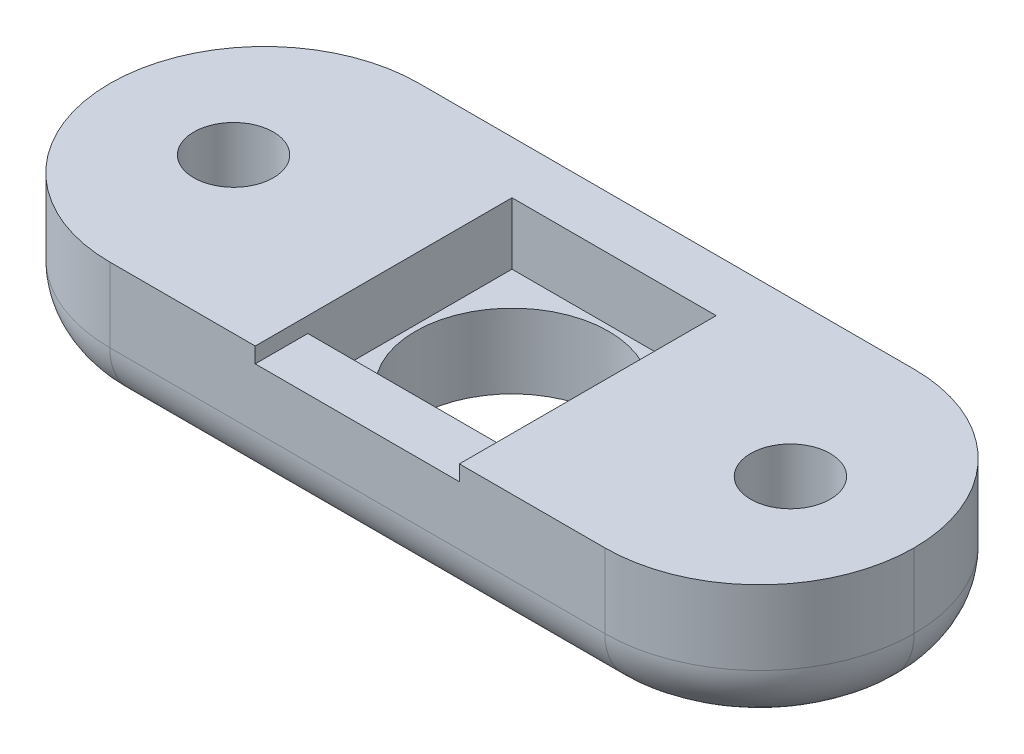
from build123d import *

# Parameters (mm, degrees)
SKETCH1_W                 = 33.02
SKETCH1_H                 = 12.7
SKETCH1_R                 = 3.96875
BOSS_EXTRUDE1_DEPTH       = 5.588
SKETCH2_W                 = 8.382
SKETCH2_H                 = 8.382
CUT_EXTRUDE1_DEPTH        = 2.54
F_4_CLEARANCE_HOLE1_D     = 3.2639
F_4_CLEARANCE_HOLE1_DEPTH = 12.7
F_4_CLEARANCE_HOLE1_TIP   = 0.980574487
FILLET1_R                 = 6.35
SKETCH7_W                 = 8.382
SKETCH7_H                 = 2.159
CUT_EXTRUDE2_DEPTH        = 0.635
SKETCH9_R                 = 2.54
CUT_EXTRUDE3_DEPTH        = 3.175
FILLET3_R                 = 2.54


# Some blends are built 0.0001 mm under size
with BuildPart() as part:
    # Sketch1 → Boss-Extrude1 (new body)
    with BuildSketch(Plane(origin=(0, 0, 0), x_dir=(1, 0, 0), z_dir=(0, 1, 0))):
        with Locations((-15.345948133, 4.349128799)):
            Rectangle(SKETCH1_W, SKETCH1_H)
        with Locations(Location((-15.345948133, 4.349128799, 0), (0, 0, 270))):
            Circle(SKETCH1_R, mode=Mode.SUBTRACT)
    extrude(amount=BOSS_EXTRUDE1_DEPTH)

    # Sketch2 → Cut-Extrude1 (cut)
    with BuildSketch(Plane(origin=(0, 5.588, 0), x_dir=(1, 0, 0), z_dir=(0, 1, 0))):
        with Locations((-15.345948133, 4.349128799)):
            Rectangle(SKETCH2_W, SKETCH2_H)
    extrude(amount=-CUT_EXTRUDE1_DEPTH, mode=Mode.SUBTRACT)

    # #4 Clearance Hole1
    with Locations(Plane(origin=(0, 0, 0), x_dir=(-1, 0, 0), z_dir=(0, -1, 0))):
        with Locations((3.915948133, 4.349128799), (26.775948133, 4.349128799)):
            Hole(F_4_CLEARANCE_HOLE1_D / 2, depth=F_4_CLEARANCE_HOLE1_DEPTH)
            with Locations((0, 0, -(F_4_CLEARANCE_HOLE1_DEPTH + F_4_CLEARANCE_HOLE1_TIP / 2))):  # 118° drill point
                Cone(0, F_4_CLEARANCE_HOLE1_D / 2, F_4_CLEARANCE_HOLE1_TIP, mode=Mode.SUBTRACT)

    # Fillet1
    fillet1_edges = [part.edges().sort_by_distance(p)[0] for p in [
        (-31.855948133, 2.794, 2.000871201),
        (-31.855948133, 2.794, -10.699128799),
        (1.164051867, 2.794, -10.699128799),
        (1.164051867, 2.794, 2.000871201),
    ]]
    fillet(fillet1_edges, radius=FILLET1_R - 0.0001)  # a hair under: the kernel refuses the full size

    # Sketch7 → Cut-Extrude2 (cut)
    with BuildSketch(Plane(origin=(0, 5.588, 0), x_dir=(1, 0, 0), z_dir=(0, 1, 0))):
        with Locations((-15.345948133, -0.921371201)):
            Rectangle(SKETCH7_W, SKETCH7_H)
    extrude(amount=-CUT_EXTRUDE2_DEPTH, mode=Mode.SUBTRACT)

    # Sketch9 → Cut-Extrude3 (cut)
    with BuildSketch(Plane.XZ):
        with Locations(Location((-3.915948133, -4.349128799, 0), (0, 0, 270))):
            Circle(SKETCH9_R)
        with Locations(Location((-26.775948133, -4.349128799, 0), (0, 0, 270))):
            Circle(SKETCH9_R)
    extrude(amount=-CUT_EXTRUDE3_DEPTH, mode=Mode.SUBTRACT)

    # Fillet3
    # the kernel refuses this fillet: 2.54 mm, written as the material it takes off along each edge
    with BuildSketch(Plane(origin=(-25.506048133, 0, 2.000871201), x_dir=(0, 0, -1), z_dir=(1, 0, 0))) as fillet3_piece_1:
        with BuildLine():
            CenterArc((FILLET3_R, FILLET3_R), FILLET3_R, 180, 90)
            Line((0, FILLET3_R), (0, 0))
            Line((0, 0), (FILLET3_R, 0))
        make_face()
    extrude(amount=20.3202, mode=Mode.SUBTRACT)
    with BuildSketch(Plane(origin=(-5.185848133, 0, -10.699128799), x_dir=(0, 1, 0), z_dir=(-1, 0, 0))) as fillet3_piece_2:
        with BuildLine():
            CenterArc((FILLET3_R, -FILLET3_R), FILLET3_R, 90, 90)
            Line((0, -FILLET3_R), (0, 0))
            Line((0, 0), (FILLET3_R, 0))
        make_face()
    extrude(amount=20.3202, mode=Mode.SUBTRACT)
    with BuildSketch(Plane(origin=(-5.185848133, 0, -4.349028799), x_dir=(1, 0, 0), z_dir=(0, 0, -1))) as fillet3_piece_3:
        with BuildLine():
            CenterArc((6.3499 - FILLET3_R, -FILLET3_R), FILLET3_R, 0, 90)
            Line((6.3499, -FILLET3_R), (6.3499, 0))
            Line((6.3499, 0), (6.3499 - FILLET3_R, 0))
        make_face()
    revolve(axis=Axis((-5.185848133, 0, -4.349028799), (0, -1, 0)), revolution_arc=90, mode=Mode.SUBTRACT)
    with BuildSketch(Plane(origin=(-5.185848133, 0, -4.349228799), x_dir=(0, 0, -1), z_dir=(-1, 0, 0))) as fillet3_piece_4:
        with BuildLine():
            CenterArc((6.3499 - FILLET3_R, -FILLET3_R), FILLET3_R, 0, 90)
            Line((6.3499, -FILLET3_R), (6.3499, 0))
            Line((6.3499, 0), (6.3499 - FILLET3_R, 0))
        make_face()
    revolve(axis=Axis((-5.185848133, 0, -4.349228799), (0, -1, 0)), revolution_arc=90, mode=Mode.SUBTRACT)
    with BuildSketch(Plane(origin=(-25.506048133, 0, -4.349228799), x_dir=(0, 0, -1), z_dir=(1, 0, 0))) as fillet3_piece_5:
        with BuildLine():
            CenterArc((6.3499 - FILLET3_R, FILLET3_R), FILLET3_R, 270, 90)
            Line((6.3499, FILLET3_R), (6.3499, 0))
            Line((6.3499, 0), (6.3499 - FILLET3_R, 0))
        make_face()
    revolve(axis=Axis((-25.506048133, 0, -4.349228799), (0, 1, 0)), revolution_arc=90, mode=Mode.SUBTRACT)
    with BuildSketch(Plane(origin=(-25.506048133, 0, -4.349028799), x_dir=(-1, 0, 0), z_dir=(0, 0, -1))) as fillet3_piece_6:
        with BuildLine():
            CenterArc((6.3499 - FILLET3_R, FILLET3_R), FILLET3_R, 270, 90)
            Line((6.3499, FILLET3_R), (6.3499, 0))
            Line((6.3499, 0), (6.3499 - FILLET3_R, 0))
        make_face()
    revolve(axis=Axis((-25.506048133, 0, -4.349028799), (0, 1, 0)), revolution_arc=90, mode=Mode.SUBTRACT)
    with BuildSketch(Plane(origin=(-31.855948133, 0, -4.349228799), x_dir=(1, 0, 0), z_dir=(0, 0, 1)), Plane(origin=(1.164051867, 0, -4.349028799), x_dir=(-1, 0, 0), z_dir=(0, 0, -1))) as fillet3_piece_7:
        with BuildLine():
            CenterArc((FILLET3_R, FILLET3_R), FILLET3_R, 180, 90)
            Line((0, FILLET3_R), (0, 0))
            Line((0, 0), (FILLET3_R, 0))
        make_face()
    extrude(amount=0.0002, mode=Mode.SUBTRACT)


solid = part.part
